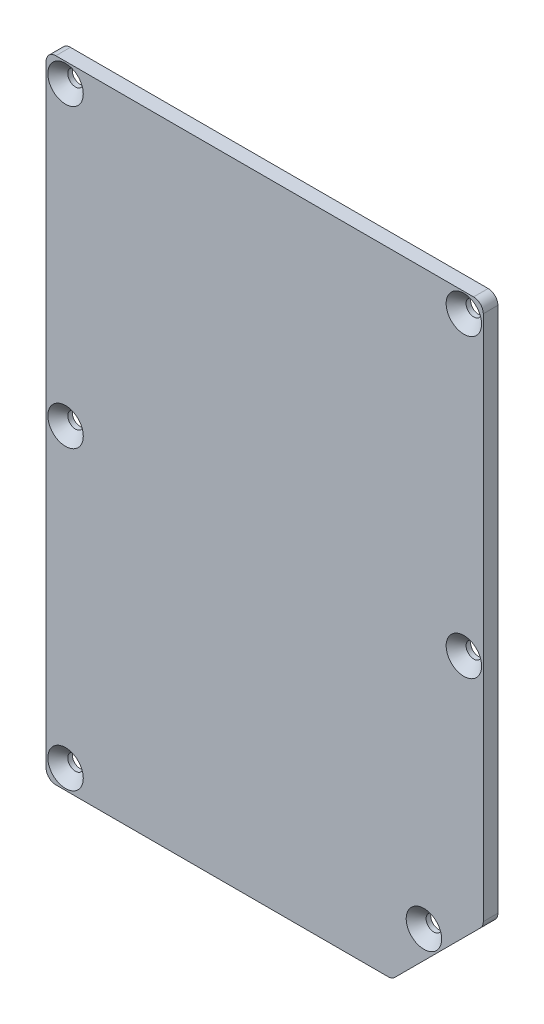
from build123d import *

# Parameters (mm, degrees)
BOSS_EXTRUDE1_DEPTH                                 = 3
CSK_FOR_M3_COUNTERSUNK_FLAT_HEAD_SCREW1_D           = 3.2
CSK_FOR_M3_COUNTERSUNK_FLAT_HEAD_SCREW1_DEPTH       = 5
CSK_FOR_M3_COUNTERSUNK_FLAT_HEAD_SCREW1_CSINK_D     = 7.3
CSK_FOR_M3_COUNTERSUNK_FLAT_HEAD_SCREW1_CSINK_ANGLE = 90
CSK_FOR_M3_COUNTERSUNK_FLAT_HEAD_SCREW1_TIP         = 0.96137699


with BuildPart() as part:
    # Sketch1 → Boss-Extrude1 (new body)
    with BuildSketch(Plane.XY):
        with BuildLine():
            Line((-43, 70), (43, 70))
            ThreePointArc((43, 70), (44.414213562, 69.414213562), (45, 68))
            Line((45, 68), (45, -40.384776311))
            ThreePointArc((45, -40.384776311), (44.847759065, -41.150143176), (44.414213562, -41.798989873))
            Line((44.414213562, -41.798989873), (26.798989873, -59.414213562))
            ThreePointArc((26.798989873, -59.414213562), (26.150143176, -59.847759065), (25.384776311, -60))
            Line((25.384776311, -60), (-43, -60))
            ThreePointArc((-43, -60), (-44.414213562, -59.414213562), (-45, -58))
            Line((-45, -58), (-45, 68))
            ThreePointArc((-45, 68), (-44.414213562, 69.414213562), (-43, 70))
        make_face()
    extrude(amount=BOSS_EXTRUDE1_DEPTH)

    # CSK for M3 Countersunk Flat Head Screw1
    with Locations(Plane(origin=(-41, -56, 3), x_dir=(1, 0, 0), z_dir=(0, 0, 1))):
        with Locations((0, 0), (73.778174593, 8.221825407), (82, 61), (0, 61), (0, 122), (82, 122)):
            CounterSinkHole(CSK_FOR_M3_COUNTERSUNK_FLAT_HEAD_SCREW1_D / 2, CSK_FOR_M3_COUNTERSUNK_FLAT_HEAD_SCREW1_CSINK_D / 2, depth=CSK_FOR_M3_COUNTERSUNK_FLAT_HEAD_SCREW1_DEPTH, counter_sink_angle=CSK_FOR_M3_COUNTERSUNK_FLAT_HEAD_SCREW1_CSINK_ANGLE)
            with Locations((0, 0, -(CSK_FOR_M3_COUNTERSUNK_FLAT_HEAD_SCREW1_DEPTH + CSK_FOR_M3_COUNTERSUNK_FLAT_HEAD_SCREW1_TIP / 2))):  # 118° drill point
                Cone(0, CSK_FOR_M3_COUNTERSUNK_FLAT_HEAD_SCREW1_D / 2, CSK_FOR_M3_COUNTERSUNK_FLAT_HEAD_SCREW1_TIP, mode=Mode.SUBTRACT)


solid = part.part
